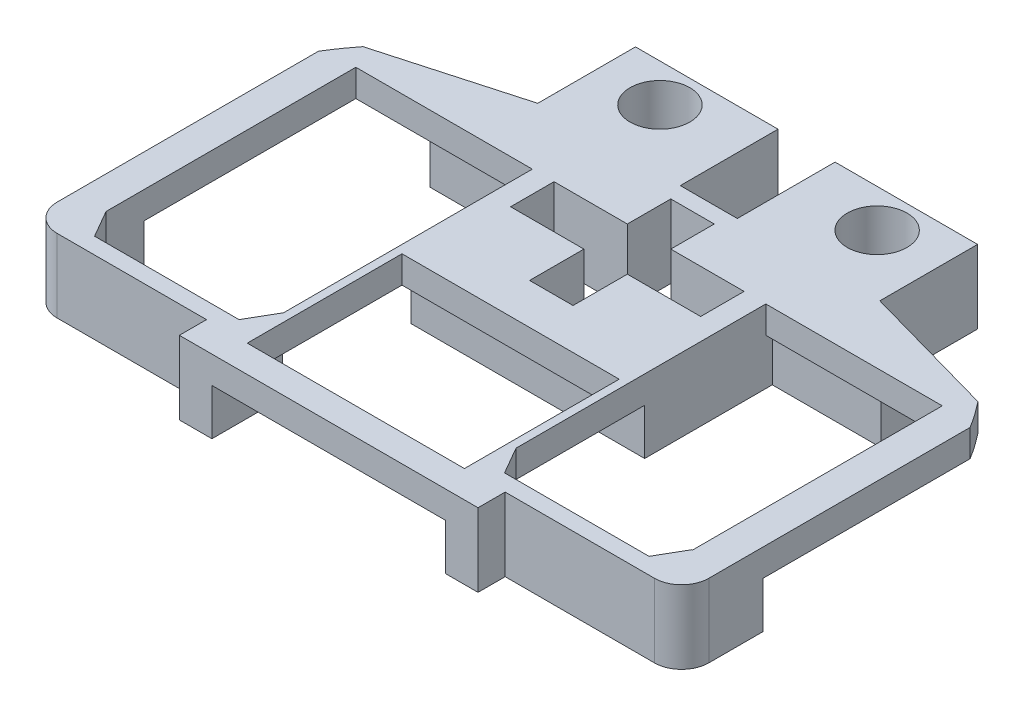
from build123d import *
from OCP.BRepFilletAPI import BRepFilletAPI_MakeChamfer
from build123d.topology import SkipClean

# Parameters (mm, degrees)
SKETCH1_W           = 40
SKETCH1_H           = 28.5
SKETCH1_R           = 3
BOSS_EXTRUDE1_DEPTH = 5
SKETCH2_W           = 32.5
SKETCH2_H           = 51
CUT_EXTRUDE1_DEPTH  = 10
SKETCH3_W           = 137.62708118
SKETCH3_H           = 29.533708408
CUT_EXTRUDE2_DEPTH  = 10
BOSS_EXTRUDE2_START = 8.5
SKETCH4_R           = 3
BOSS_EXTRUDE2_DEPTH = 8.5
FILLET1_R           = 5
SKETCH5_W           = 8
SKETCH5_H           = 8
SKETCH5_W_2         = 35
SKETCH5_H_2         = 10
CUT_EXTRUDE3_DEPTH  = 13.5
BOSS_EXTRUDE6_START = -13.5
SKETCH6_W           = 3
SKETCH6_H           = 5
BOSS_EXTRUDE6_DEPTH = 13.5
CUT_EXTRUDE4_START  = -10
SKETCH7_R           = 5.5
SKETCH7_R_2         = 3
CUT_EXTRUDE4_DEPTH  = 10
CHAMFER1_SIZE       = 5
CHAMFER1_SIZE_2     = 2.886751346
CHAMFER2_SIZE       = 5.196152423
CHAMFER2_SIZE_2     = 3


# Some blends are built 0.0001 mm under size
with BuildPart() as part:
    # Sketch1 → Boss-Extrude1 (new body)
    with BuildSketch(Plane(origin=(0, 0, 0), x_dir=(1, 0, 0), z_dir=(0, 1, 0))):
        with BuildLine():
            Line((-31.5, 11), (-31.5, -11))
            Line((-31.5, -11), (-56.629054395, -18.053769655))
            add(Edge.make_bspline(
                [(-56.629054395, -18.053769655), (-58.486129852, -20.409089771), (-60, -22.885467918)],
                knots=[0.137055219, 0.137055219, 0.137055219, 0.224914017, 0.224914017, 0.224914017], degree=2))
            Line((-60, -22.885467918), (-60, -76))
            Line((-60, -76), (-27.5, -76))
            Line((-27.5, -76), (-27.5, -81))
            Line((-27.5, -81), (27.5, -81))
            Line((27.5, -81), (27.5, -76))
            Line((27.5, -76), (60, -76))
            Line((60, -76), (60, -22.885467918))
            add(Edge.make_bspline(
                [(56.629054395, -18.053769655), (58.486129852, -20.409089771), (60, -22.885467918)],
                knots=[0.137055219, 0.137055219, 0.137055219, 0.224914017, 0.224914017, 0.224914017], degree=2))
            Line((56.629054395, -18.053769655), (31.5, -11))
            Line((31.5, -11), (31.5, 11))
            Line((31.5, 11), (5.25, 11))
            Line((5.25, 11), (5.25, -11))
            Line((5.25, -11), (-5.25, -11))
            Line((-5.25, -11), (-5.25, 11))
            Line((-5.25, 11), (-31.5, 11))
        make_face()
        with Locations((0, -61.75)):
            Rectangle(SKETCH1_W, SKETCH1_H, mode=Mode.SUBTRACT)
        with Locations(Location((-20, 0, 0), (0, 0, 270))):
            Circle(SKETCH1_R, mode=Mode.SUBTRACT)
        with Locations(Location((20, 0, 0), (0, 0, 270))):
            Circle(SKETCH1_R, mode=Mode.SUBTRACT)
    extrude(amount=BOSS_EXTRUDE1_DEPTH)

    # Sketch2 → Cut-Extrude1 (cut)
    with BuildSketch(Plane(origin=(0, 5, 0), x_dir=(1, 0, 0), z_dir=(0, 1, 0))):
        with Locations((-37.75, -47.5)):
            Rectangle(SKETCH2_W, SKETCH2_H)
        with Locations((37.75, -47.5)):
            Rectangle(SKETCH2_W, SKETCH2_H)
    extrude(amount=-CUT_EXTRUDE1_DEPTH, mode=Mode.SUBTRACT)

    # Sketch3 → Cut-Extrude2 (cut)
    with BuildSketch(Plane(origin=(0, 5, 0), x_dir=(1, 0, 0), z_dir=(0, 1, 0))):
        with Locations((-0.764574483, 21.766854204)):
            Rectangle(SKETCH3_W, SKETCH3_H)
    extrude(amount=-CUT_EXTRUDE2_DEPTH, mode=Mode.SUBTRACT)

    # Sketch4 → Boss-Extrude2 (add)
    # profile 1 of 3: a face of its own
    with SkipClean():  # the faces are left unmerged after this step: merging them gives an invalid solid
        with BuildSketch(Plane.XZ.offset(BOSS_EXTRUDE2_START)):
            Polygon((-41.5, 20.807017544), (-41.5, 13.807017544), (-31.5, 11), (-31.5, -7), (-5.25, -7), (-5.25, 11), (5.25, 11), (5.25, -7), (31.5, -7), (31.5, 11), (41.5, 13.807017544), (41.5, 20.807017544), (21.5, 20.807017544), (21.5, 44.307017544), (-21.5, 44.307017544), (-21.5, 20.807017544), align=None)
            with Locations(Location((-20, 0, 0), (0, 0, 270))):
                Circle(SKETCH4_R, mode=Mode.SUBTRACT)
            with Locations(Location((20, 0, 0), (0, 0, 270))):
                Circle(SKETCH4_R, mode=Mode.SUBTRACT)
        # profile 2 of 3: a face of its own
        with BuildSketch(Plane.XZ.offset(BOSS_EXTRUDE2_START)):
            Polygon((-60, 61), (-54, 61), (-54, 73), (-21.5, 73), (-21.5, 81), (-27.5, 81), (-27.5, 76), (-60, 76), align=None)
        # profile 3 of 3: a face of its own
        with BuildSketch(Plane.XZ.offset(BOSS_EXTRUDE2_START)):
            Polygon((27.5, 81), (21.5, 81), (21.5, 73), (54, 73), (54, 61), (60, 61), (59.999999958, 73), (60, 76), (27.5, 76), align=None)
        extrude(amount=-BOSS_EXTRUDE2_DEPTH)

    # Fillet1
    fillet1_edges = [part.edges().sort_by_distance(p)[0] for p in [
        (60, -4.25, 76),
        (-60, -4.25, 76),
    ]]
    fillet(fillet1_edges, radius=FILLET1_R)

    # Sketch5 → Cut-Extrude3 (cut)
    with SkipClean():  # the faces are left unmerged after this step: merging them gives an invalid solid
        with BuildSketch(Plane(origin=(0, 5, 0), x_dir=(1, 0, 0), z_dir=(0, 1, 0))):
            with Locations((0, -18)):
                Rectangle(SKETCH5_W, SKETCH5_H)
            with Locations((0, -26)):
                Rectangle(SKETCH5_W_2, SKETCH5_H)
            with Locations((0, -35)):
                Rectangle(SKETCH5_W, SKETCH5_H_2)
        extrude(amount=-CUT_EXTRUDE3_DEPTH, mode=Mode.SUBTRACT)

    # Sketch6 → Boss-Extrude6 (add)
    with SkipClean():  # the faces are left unmerged after this step: merging them gives an invalid solid
        with BuildSketch(Plane(origin=(0, 5, 0), x_dir=(1, 0, 0), z_dir=(0, 1, 0)).offset(BOSS_EXTRUDE6_START)):
            with Locations((-52.5, -70.5)):
                Rectangle(SKETCH6_W, SKETCH6_H)
            with Locations((-23, -70.5)):
                Rectangle(SKETCH6_W, SKETCH6_H)
            Polygon((-21.5, -73), (-24.5, -73), (-27.5, -73), (-27.5, -76), (-21.5, -76), align=None)
            with Locations((23, -70.5)):
                Rectangle(SKETCH6_W, SKETCH6_H)
            Polygon((27.5, -73), (24.5, -73), (21.5, -73), (21.5, -76), (27.5, -76), align=None)
            with Locations((52.5, -70.5)):
                Rectangle(SKETCH6_W, SKETCH6_H)
        extrude(amount=BOSS_EXTRUDE6_DEPTH)

    # Sketch7 → Cut-Extrude4 (cut)
    # profile 1 of 2: a face of its own
    with BuildSketch(Plane(origin=(0, 5, 0), x_dir=(1, 0, 0), z_dir=(0, 1, 0)).offset(CUT_EXTRUDE4_START)):
        with Locations(Location((-20, 0, 0), (0, 0, 270))):
            Circle(SKETCH7_R)
        with Locations(Location((-20, 0, 0), (0, 0, 90))):
            Circle(SKETCH7_R_2, mode=Mode.SUBTRACT)
    # profile 2 of 2: a face of its own
    with BuildSketch(Plane(origin=(0, 5, 0), x_dir=(1, 0, 0), z_dir=(0, 1, 0)).offset(CUT_EXTRUDE4_START)):
        with Locations(Location((20, 0, 0), (0, 0, 270))):
            Circle(SKETCH7_R)
        with Locations(Location((20, 0, 0), (0, 0, 90))):
            Circle(SKETCH7_R_2, mode=Mode.SUBTRACT)
    extrude(amount=CUT_EXTRUDE4_DEPTH, mode=Mode.SUBTRACT)

    # Chamfer1
    chamfer1_edges_1 = [part.edges().sort_by_distance(p)[0] for p in [
        (51, -1.75, 68),
    ]]
    chamfer1_side_1 = [part.faces().sort_by_distance(p)[0] for p in [
        (51, -1.75, 68.057735027),
    ]]
    chamfer1_edges_2 = [part.edges().sort_by_distance(p)[0] for p in [
        (-24.5, -1.75, 68),
    ]]
    chamfer1_side_2 = [part.faces().sort_by_distance(p)[0] for p in [
        (-24.5, -1.75, 68.057735027),
    ]]
    chamfer1 = BRepFilletAPI_MakeChamfer(part.part.solid().wrapped)
    for e in chamfer1_edges_1:
        chamfer1.Add(CHAMFER1_SIZE - 0.0001, CHAMFER1_SIZE_2 - 0.0001, e.wrapped, chamfer1_side_1[0].wrapped)
    for e in chamfer1_edges_2:
        chamfer1.Add(CHAMFER1_SIZE - 0.0001, CHAMFER1_SIZE_2 - 0.0001, e.wrapped, chamfer1_side_2[0].wrapped)
    add(Compound.cast(chamfer1.Shape()), mode=Mode.REPLACE)  # a hair under: the kernel refuses the full size

    # Chamfer2
    # the kernel refuses this chamfer: 5.196152423, 3 mm, written as the material it takes off along each edge
    with BuildSketch(Plane(origin=(-51, -21.942891912, 68), x_dir=(0.01932676561269968, 0, 0.9998132206222079), z_dir=(0, 1, 0))) as chamfer2_piece_1_section:
        Polygon((CHAMFER2_SIZE * 0.999813220566, -CHAMFER2_SIZE * 0.0193267656116), (-CHAMFER2_SIZE_2 * 0.0193267656127, -CHAMFER2_SIZE_2 * 0.999813220622), (0, 0), align=None)
    chamfer2_piece_1 = extrude(amount=40.385783824, mode=Mode.PRIVATE)
    chamfer2_piece_1 = split(chamfer2_piece_1, bisect_by=Plane(origin=(-51.966537061, -1.75, 73), z_dir=(0, 0, -1)), keep=Keep.TOP, mode=Mode.PRIVATE)
    chamfer2_piece_1 = split(chamfer2_piece_1, bisect_by=Plane(origin=(-54, -1.75, 69.717275258), z_dir=(1, 0, 0)), keep=Keep.TOP, mode=Mode.PRIVATE)
    add(chamfer2_piece_1, mode=Mode.SUBTRACT)
    with BuildSketch(Plane(origin=(24.5, -21.942891912, 68), x_dir=(0.019326765612701, 0, 0.9998132206222079), z_dir=(0, 1, 0))) as chamfer2_piece_2_section:
        Polygon((CHAMFER2_SIZE * 0.999813220566, -CHAMFER2_SIZE * 0.0193267656116), (-CHAMFER2_SIZE_2 * 0.0193267656127, -CHAMFER2_SIZE_2 * 0.999813220622), (0, 0), align=None)
    chamfer2_piece_2 = extrude(amount=40.385783824, mode=Mode.PRIVATE)
    chamfer2_piece_2 = split(chamfer2_piece_2, bisect_by=Plane(origin=(23.533462939, -1.75, 73), z_dir=(0, 0, -1)), keep=Keep.TOP, mode=Mode.PRIVATE)
    add(chamfer2_piece_2, mode=Mode.SUBTRACT)


solid = part.part
